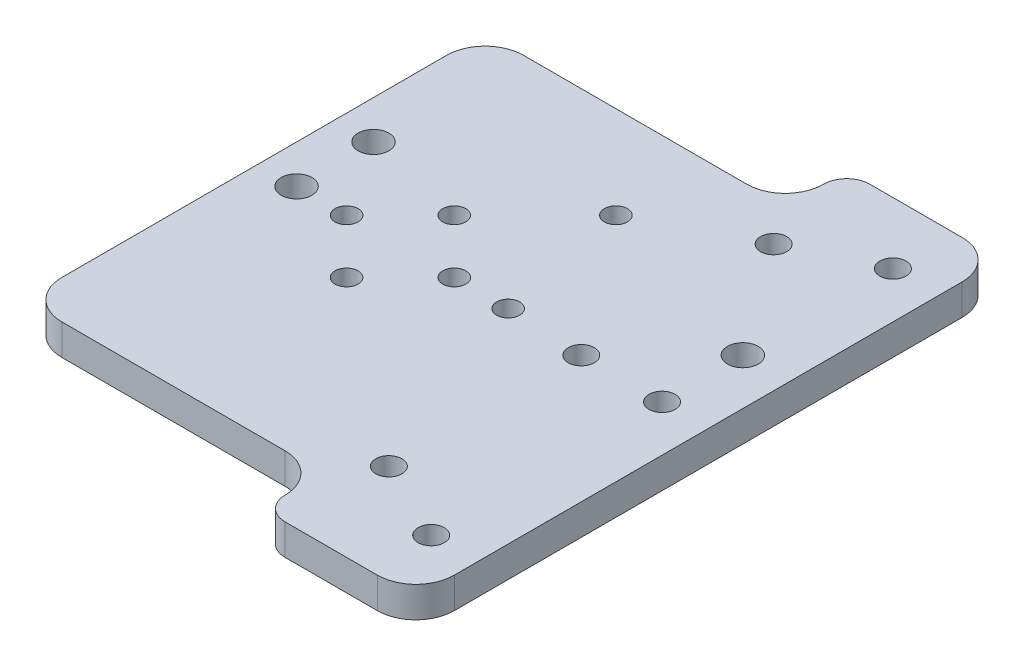
from build123d import *

# Parameters (mm, degrees)
SKETCH_1_R          = 1.7
EXTRUDE_1_DEPTH     = 4
SKETCH_2_R          = 1.5
SKETCH_2_R_2        = 2
CUT_EXTRUDE_1_DEPTH = 71.292247083
FILLET_1_R          = 5
FILLET_2_R          = 3


with BuildPart() as part:
    # 草图1 → 凸台-拉伸1 (new body)
    with BuildSketch(Plane(origin=(0, 0, 0), x_dir=(1, 0, 0), z_dir=(0, 1, 0))):
        Polygon((0, 0), (0, 30), (39, 30), (39, 38), (59, 38), (59, -38), (39, -38), (39, -30), (0, -30), align=None)
        with Locations(Location((42.5, 25, 0), (0, 0, 270))):
            Circle(SKETCH_1_R, mode=Mode.SUBTRACT)
        with Locations(Location((42.5, -25, 0), (0, 0, 270))):
            Circle(SKETCH_1_R, mode=Mode.SUBTRACT)
        with Locations(Location((42.5, 0, 0), (0, 0, 270))):
            Circle(SKETCH_1_R, mode=Mode.SUBTRACT)
        with Locations(Location((53, 30, 0), (0, 0, 270))):
            Circle(SKETCH_1_R, mode=Mode.SUBTRACT)
        with Locations(Location((53, 0, 0), (0, 0, 270))):
            Circle(SKETCH_1_R, mode=Mode.SUBTRACT)
        with Locations(Location((53, -30, 0), (0, 0, 270))):
            Circle(SKETCH_1_R, mode=Mode.SUBTRACT)
    extrude(amount=EXTRUDE_1_DEPTH)

    # 草图2 → 切除-拉伸1 (cut, through all)
    with BuildSketch(Plane(origin=(0, 4, 0), x_dir=(1, 0, 0), z_dir=(0, 1, 0))):
        with Locations(Location((32.5, 0.5, 0), (0, 0, 270))):
            Circle(SKETCH_2_R)
        with Locations(Location((5, 0.5, 0), (0, 0, 270))):
            Circle(SKETCH_2_R_2)
        with Locations(Location((5, 10.5, 0), (0, 0, 270))):
            Circle(SKETCH_2_R_2)
        with Locations(Location((53, 10.5, 0), (0, 0, 270))):
            Circle(SKETCH_2_R_2)
        with Locations(Location((29, 18, 0), (0, 0, 270))):
            Circle(SKETCH_2_R)
        with Locations(Location((18.5, -6.5, 0), (0, 0, 270))):
            Circle(SKETCH_2_R)
        with Locations(Location((11.5, 0.5, 0), (0, 0, 270))):
            Circle(SKETCH_2_R)
        with Locations(Location((25.5, 0.5, 0), (0, 0, 270))):
            Circle(SKETCH_2_R)
        with Locations(Location((18.5, 7.5, 0), (0, 0, 270))):
            Circle(SKETCH_2_R)
    extrude(amount=-CUT_EXTRUDE_1_DEPTH, mode=Mode.SUBTRACT)

    # 圆角1
    fillet_1_edges = [part.edges().sort_by_distance(p)[0] for p in [
        (59, 2, 38),
        (39, 2, 30),
        (0, 2, 30),
        (0, 2, -30),
        (39, 2, -30),
        (59, 2, -38),
    ]]
    fillet(fillet_1_edges, radius=FILLET_1_R)

    # 圆角2
    fillet_2_edges = [part.edges().sort_by_distance(p)[0] for p in [
        (39, 2, 38),
        (39, 2, -38),
    ]]
    fillet(fillet_2_edges, radius=FILLET_2_R - 0.0001)  # a hair under: the kernel refuses the full size


solid = part.part
